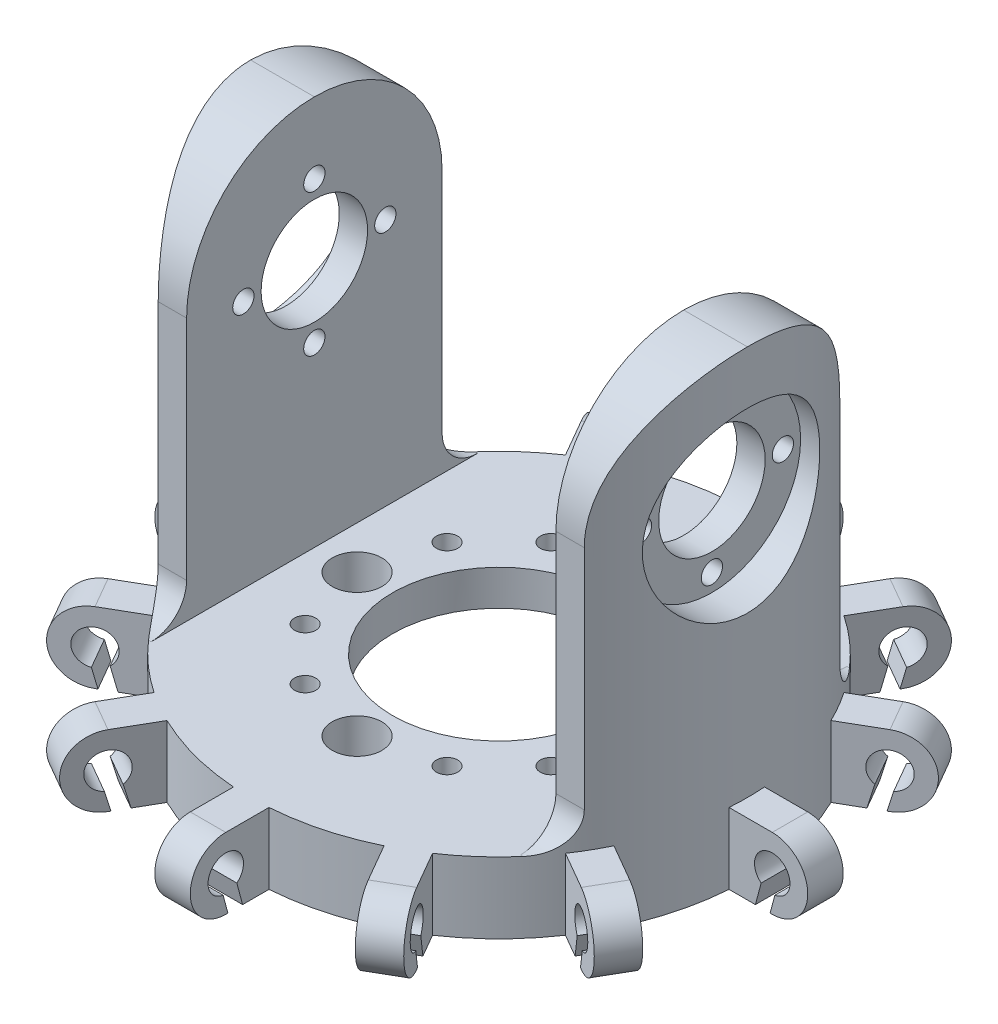
from build123d import *

# Parameters (mm, degrees)
SKETCH4_R               = 17.5
BOSS_EXTRUDE2_DEPTH     = 5
BOSS_EXTRUDE3_DEPTH     = 27.5
FILLET1_R               = 9
SKETCH6_R               = 7.5
CUT_EXTRUDE3_DEPTH      = 15
SKETCH7_R               = 12.5
CUT_EXTRUDE4_DEPTH      = 2.5
SKETCH8_R               = 0.75
CUT_EXTRUDE5_DEPTH      = 2.5
CUT_EXTRUDE6_DEPTH      = 48.887976301
CUT_EXTRUDE6_DEPTH_BACK = 48.887976301
SKETCH9_R               = 3.75
SKETCH10_R              = 6.25
CUT_EXTRUDE7_DEPTH      = 2.5
FILLET2_R               = 2.5
BOSS_EXTRUDE4_START     = -1.25
BOSS_EXTRUDE4_OUTLINE_R = 1.25
BOSS_EXTRUDE4_DEPTH     = 2.5
CUT_EXTRUDE8_DEPTH      = 2.5
CIRPATTERN2_COUNT       = 12
SKETCH14_R              = 1.75
CUT_EXTRUDE9_DEPTH      = 10
SKETCH15_R              = 0.75
CUT_EXTRUDE10_DEPTH     = 56.038622862
CIRPATTERN3_COUNT       = 4
SKETCH16_R              = 1.25
CUT_EXTRUDE11_DEPTH     = 2.5


# Read off the part's stored shape, not the designer's step: Boss-Extrude4
# Some blends are built 0.0001 mm under size
with BuildPart() as part:
    # Sketch4 → Boss-Extrude2 (new body)
    with BuildSketch(Plane(origin=(0, 0, 0), x_dir=(1, 0, 0), z_dir=(0, 1, 0))):
        with Locations(Location((0, 0, 0), (0, 0, 270))):
            Circle(SKETCH4_R)
    extrude(amount=BOSS_EXTRUDE2_DEPTH)

    # Sketch5 → Boss-Extrude3 (add)
    with BuildSketch(Plane(origin=(0, 5, 0), x_dir=(1, 0, 0), z_dir=(0, 1, 0))):
        with BuildLine():
            Line((-13.00833102, -9), (-13.00833102, 9))
            Line((-13.00833102, 9), (-15.00833102, 9))
            ThreePointArc((-15.00833102, 9), (-17.5, 0), (-15.00833102, -9))
            Line((-15.00833102, -9), (-13.00833102, -9))
        make_face()
        with BuildLine():
            Line((15.00833102, 9), (13.00833102, 9))
            Line((13.00833102, 9), (13.00833102, -9))
            Line((13.00833102, -9), (15.00833102, -9))
            ThreePointArc((15.00833102, -9), (16.865583193, -4.669272275), (17.5, 0))
            ThreePointArc((17.5, 0), (16.865583193, 4.669272275), (15.00833102, 9))
        make_face()
    extrude(amount=BOSS_EXTRUDE3_DEPTH)

    # Fillet1
    fillet1_edges = [part.edges().sort_by_distance(p)[0] for p in [
        (-14.00833102, 32.5, -9),
        (-14.00833102, 32.5, 9),
        (14.00833102, 32.5, -9),
        (14.00833102, 32.5, 9),
    ]]
    fillet(fillet1_edges, radius=FILLET1_R - 0.0001)  # a hair under: the kernel refuses the full size

    # Sketch6 → Cut-Extrude3 (cut)
    with BuildSketch(Plane(origin=(0, 5, 0), x_dir=(1, 0, 0), z_dir=(0, 1, 0))):
        with Locations(Location((0, 0, 0), (0, 0, 270))):
            Circle(SKETCH6_R)
    extrude(amount=-CUT_EXTRUDE3_DEPTH, mode=Mode.SUBTRACT)

    # Sketch7 → Cut-Extrude4 (cut)
    with BuildSketch(Plane.XZ):
        with Locations(Location((0, 0, 0), (0, 0, 270))):
            Circle(SKETCH7_R)
    extrude(amount=-CUT_EXTRUDE4_DEPTH, mode=Mode.SUBTRACT)

    # Sketch8 → Cut-Extrude5 (cut)
    with BuildSketch(Plane.XZ.offset(-2.5)):
        with Locations(Location((0, 10, 0), (0, 0, 270))):
            Circle(SKETCH8_R)
        with Locations(Location((5, 8.660254038, 0), (0, 0, 270))):
            Circle(SKETCH8_R)
        with Locations(Location((8.660254038, 5, 0), (0, 0, 270))):
            Circle(SKETCH8_R)
        with Locations(Location((10, 0, 0), (0, 0, 270))):
            Circle(SKETCH8_R)
        with Locations(Location((8.660254038, -5, 0), (0, 0, 270))):
            Circle(SKETCH8_R)
        with Locations(Location((5, -8.660254038, 0), (0, 0, 270))):
            Circle(SKETCH8_R)
        with Locations(Location((0, -10, 0), (0, 0, 270))):
            Circle(SKETCH8_R)
        with Locations(Location((-5, -8.660254038, 0), (0, 0, 270))):
            Circle(SKETCH8_R)
        with Locations(Location((-8.660254038, -5, 0), (0, 0, 270))):
            Circle(SKETCH8_R)
        with Locations(Location((-10, 0, 0), (0, 0, 270))):
            Circle(SKETCH8_R)
        with Locations(Location((-8.660254038, 5, 0), (0, 0, 270))):
            Circle(SKETCH8_R)
        with Locations(Location((-5, 8.660254038, 0), (0, 0, 270))):
            Circle(SKETCH8_R)
    extrude(amount=-CUT_EXTRUDE5_DEPTH, mode=Mode.SUBTRACT)

    # Sketch9 → Cut-Extrude6 (cut, two sides: drawn at the far end of the back side and taken through both)
    with BuildSketch(Plane.ZY.offset(-13.00833102).offset(-CUT_EXTRUDE6_DEPTH_BACK)):
        with Locations(Location((0, 22.5, 0), (0, 0, 270))):
            Circle(SKETCH9_R)
    extrude(amount=CUT_EXTRUDE6_DEPTH + CUT_EXTRUDE6_DEPTH_BACK, mode=Mode.SUBTRACT)

    # Sketch10 → Cut-Extrude7 (cut)
    with BuildSketch(Plane(origin=(17.5, 0, 0), x_dir=(0, 0, -1), z_dir=(1, 0, 0))):
        with Locations((0, 22.5)):
            Circle(SKETCH10_R)
    cut_extrude7 = extrude(amount=-CUT_EXTRUDE7_DEPTH, mode=Mode.SUBTRACT)

    # Mirror1: Cut-Extrude7 across plane
    add(cut_extrude7.mirror(Plane(origin=(0, 0, 0), x_dir=(0, 0, 1), z_dir=(1, 0, 0))), mode=Mode.SUBTRACT)

    # Fillet2
    # the kernel refuses this fillet: 2.5 mm, written as the material it adds along each edge
    with BuildSketch(Plane(origin=(13.00833102, 5, 9), x_dir=(0, 0, 1), z_dir=(1, 0, 0))) as fillet2_piece_1_section:
        with BuildLine():
            CenterArc((FILLET2_R, -FILLET2_R), FILLET2_R, 90, 90)
            Line((0, -FILLET2_R), (0, 0))
            Line((0, 0), (FILLET2_R, 0))
        make_face()
    fillet2_piece_1 = extrude(amount=8.25, mode=Mode.PRIVATE)
    fillet2_piece_1 = fillet2_piece_1 & Plane(origin=(0, 5.636608776, 0), x_dir=(0, 0, 1), z_dir=(0, -1, 0)) * Cylinder(17.5, 27, mode=Mode.PRIVATE)
    add(fillet2_piece_1)
    with BuildSketch(Plane(origin=(21.25833102, 5, -9), x_dir=(0, 0, -1), z_dir=(-1, 0, 0))) as fillet2_piece_2_section:
        with BuildLine():
            CenterArc((FILLET2_R, -FILLET2_R), FILLET2_R, 90, 90)
            Line((0, -FILLET2_R), (0, 0))
            Line((0, 0), (FILLET2_R, 0))
        make_face()
    fillet2_piece_2 = extrude(amount=8.25, mode=Mode.PRIVATE)
    fillet2_piece_2 = fillet2_piece_2 & Plane(origin=(0, 5.636608778, 0), x_dir=(0, 0, 1), z_dir=(0, -1, 0)) * Cylinder(17.5, 27, mode=Mode.PRIVATE)
    add(fillet2_piece_2)
    with BuildSketch(Plane(origin=(-13.00833102, 5, -9), x_dir=(0, 0, -1), z_dir=(-1, 0, 0))) as fillet2_piece_3_section:
        with BuildLine():
            CenterArc((FILLET2_R, -FILLET2_R), FILLET2_R, 90, 90)
            Line((0, -FILLET2_R), (0, 0))
            Line((0, 0), (FILLET2_R, 0))
        make_face()
    fillet2_piece_3 = extrude(amount=8.25, mode=Mode.PRIVATE)
    fillet2_piece_3 = fillet2_piece_3 & Plane(origin=(0, 5.636608776, 0), x_dir=(0, 0, 1), z_dir=(0, -1, 0)) * Cylinder(17.5, 27, mode=Mode.PRIVATE)
    add(fillet2_piece_3)
    with BuildSketch(Plane(origin=(-21.25833102, 5, 9), x_dir=(0, 0, 1), z_dir=(1, 0, 0))) as fillet2_piece_4_section:
        with BuildLine():
            CenterArc((FILLET2_R, -FILLET2_R), FILLET2_R, 90, 90)
            Line((0, -FILLET2_R), (0, 0))
            Line((0, 0), (FILLET2_R, 0))
        make_face()
    fillet2_piece_4 = extrude(amount=8.25, mode=Mode.PRIVATE)
    fillet2_piece_4 = fillet2_piece_4 & Plane(origin=(0, 5.636608778, 0), x_dir=(0, 0, 1), z_dir=(0, -1, 0)) * Cylinder(17.5, 27, mode=Mode.PRIVATE)
    add(fillet2_piece_4)

    # Boss-Extrude4 outline → Boss-Extrude4 (add)
    with BuildSketch(Plane(origin=(0, 0, 0), x_dir=(0, 0, -1), z_dir=(1, 0, 0)).offset(BOSS_EXTRUDE4_START)):
        with BuildLine():
            Line((-20.5, 0), (-17, 0))
            Line((-17, 0), (-17, 5))
            Line((-17, 5), (-20.5, 5))
            ThreePointArc((-20.5, 5), (-23, 2.5), (-20.5, 0))
        make_face()
        with Locations((-20.5, 2.5)):
            Circle(BOSS_EXTRUDE4_OUTLINE_R, mode=Mode.SUBTRACT)
    boss_extrude4 = extrude(amount=BOSS_EXTRUDE4_DEPTH)

    # Sketch12 → Cut-Extrude8 (cut)
    with BuildSketch(Plane(origin=(1.25, 0, 0), x_dir=(0, 0, -1), z_dir=(1, 0, 0))):
        Polygon((-20.5, 2.5), (-20.017037087, 2.629409523), (-19.312488929, 0), (-19.830127019, 0), (-20.347765109, 0), (-20.982962913, 2.370590477), align=None)
    cut_extrude8 = extrude(amount=-CUT_EXTRUDE8_DEPTH, mode=Mode.SUBTRACT)

    # CirPattern2: Boss-Extrude4, Cut-Extrude8 ×12 about axis
    cirpattern2_axis = Axis((0, 0, 0), (0, 1, 0))
    add([boss_extrude4.rotate(cirpattern2_axis, i * 360 / CIRPATTERN2_COUNT) for i in range(1, CIRPATTERN2_COUNT)])
    add([cut_extrude8.rotate(cirpattern2_axis, i * 360 / CIRPATTERN2_COUNT) for i in range(1, CIRPATTERN2_COUNT)], mode=Mode.SUBTRACT)

    # Sketch14 → Cut-Extrude9 (cut)
    with BuildSketch(Plane.XZ.offset(-2.5)):
        with Locations(Location((0, 10, 0), (0, 0, 270))):
            Circle(SKETCH14_R)
        with Locations(Location((10, 0, 0), (0, 0, 270))):
            Circle(SKETCH14_R)
        with Locations(Location((0, -10, 0), (0, 0, 270))):
            Circle(SKETCH14_R)
        with Locations(Location((-10, 0, 0), (0, 0, 270))):
            Circle(SKETCH14_R)
    extrude(amount=-CUT_EXTRUDE9_DEPTH, mode=Mode.SUBTRACT)

    # Sketch15 → Cut-Extrude10 (cut, through all)
    with BuildSketch(Plane.ZY.offset(15)):
        with Locations((0, 27.5)):
            Circle(SKETCH15_R)
    cut_extrude10 = extrude(amount=-CUT_EXTRUDE10_DEPTH, mode=Mode.SUBTRACT)

    # CirPattern3: Cut-Extrude10 ×4 about axis
    cirpattern3_axis = Axis((0, 22.5, 0), (1, 0, 0))
    for i in range(1, CIRPATTERN3_COUNT):
        add(cut_extrude10.rotate(cirpattern3_axis, i * 360 / CIRPATTERN3_COUNT), mode=Mode.SUBTRACT)

    # Sketch16 → Cut-Extrude11 (cut)
    with BuildSketch(Plane.XZ):
        with Locations(Location((0, 15, 0), (0, 0, 270))):
            Circle(SKETCH16_R)
        with Locations(Location((12.990381057, 7.5, 0), (0, 0, 270))):
            Circle(SKETCH16_R)
        with Locations(Location((12.990381057, -7.5, 0), (0, 0, 270))):
            Circle(SKETCH16_R)
        with Locations(Location((0, -15, 0), (0, 0, 270))):
            Circle(SKETCH16_R)
        with Locations(Location((-12.990381057, -7.5, 0), (0, 0, 270))):
            Circle(SKETCH16_R)
        with Locations(Location((-12.990381057, 7.5, 0), (0, 0, 270))):
            Circle(SKETCH16_R)
    extrude(amount=-CUT_EXTRUDE11_DEPTH, mode=Mode.SUBTRACT)


solid = part.part
